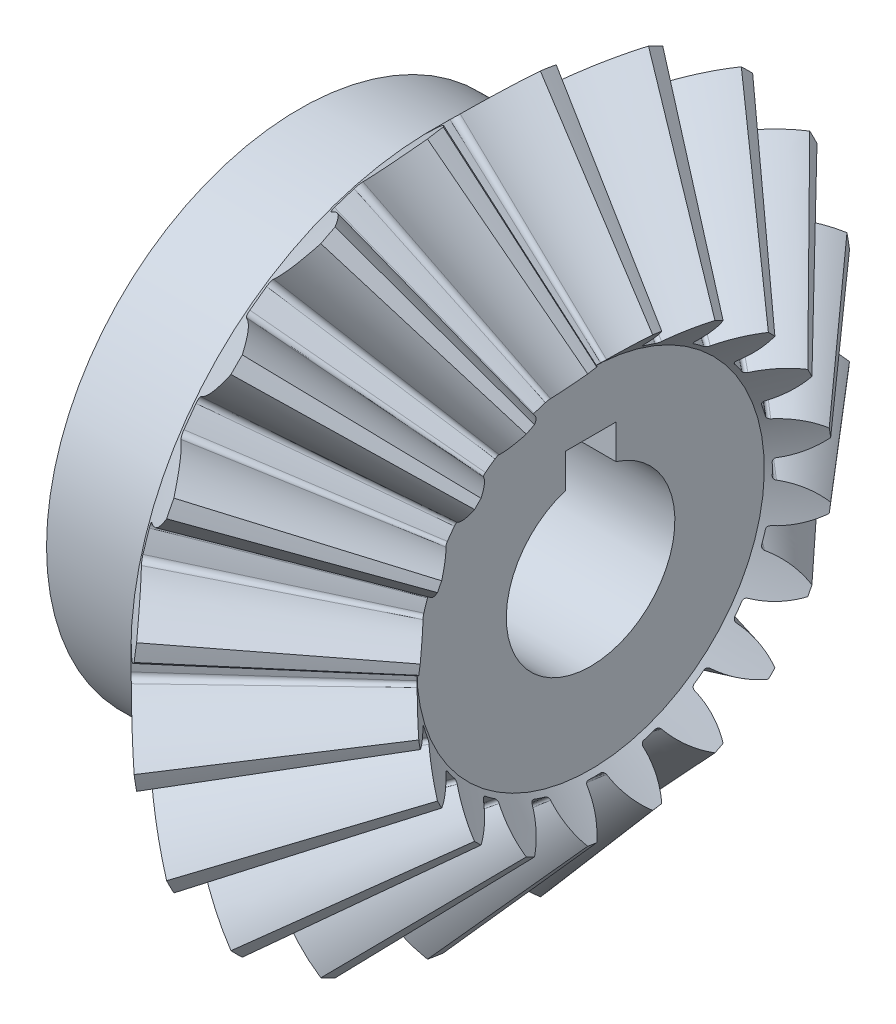
from build123d import *

# Parameters (mm, degrees)
TEETHCUTS_COUNT = 20
TEETHCUTS_ANGLE = 342
HUBSKE_R        = 15
HUB_DEPTH       = 7.901802976
BORSKE_R        = 5
BORE_DEPTH      = 30.0027432
KEYSKE_W        = 3
KEYSKE_H        = 6.8
KEYWAY_DEPTH    = 30.0027432
THREAD4_PITCH   = 0.3


with BuildPart() as part:
    # BasProSke → Base-Revolve (revolve)
    with BuildSketch(Plane(origin=(0, 0, 0), x_dir=(1, 0, 0), z_dir=(0, 1, 0)), mode=Mode.PRIVATE) as base_revolve_sk:
        Polygon((0, 0), (0, 17.899008978), (3.515204589, 21.414213561), (11.400485955, 12.328932179), (9.376656368, 10.305102596), (9.376656368, 0), align=None)
    revolve(base_revolve_sk.sketch.rotate(Axis((-10, 0, 0), (1, 0, 0)), 180), axis=Axis((-10, 0, 0), (1, 0, 0)))

    # ToothCut: read off the stored shape, not the designer's step
    # ToothCut: loft between two sections, ruled curve by curve
    toothcut_from = [
        Edge.make_bspline([(22.107036673, 0.006045648, -0.009390945), (22.102810287, 0.001819262, -0.014832638), (22.097123249, -0.003867777, -0.014025248), (22.093746048, -0.007244978, -0.007504073)], [0, 0, 0, 0, 1, 1, 1, 1], 3, [1, 0.779000961, 0.779000961, 1]),
        Edge.make_bspline([(22.093746048, -0.007244978, 0.007504073), (22.097123249, -0.003867777, 0.014025248), (22.102810287, 0.001819262, 0.014832638), (22.107036673, 0.006045648, 0.009390945)], [0, 0, 0, 0, 1, 1, 1, 1], 3, [1, 0.779000961, 0.779000961, 1]),
        Edge.make_bspline([(22.093746048, -0.007244978, -0.007504073), (22.093246357, -0.007744669, -0.006539199), (22.09284735, -0.008143676, -0.005484709), (22.092556922, -0.008434103, -0.004361469)], [0, 0, 0, 0, 1, 1, 1, 1], 3, [1, 0.993403623, 0.993403623, 1]),
        Edge.make_bspline([(22.092556922, -0.008434103, 0.004361469), (22.09284735, -0.008143676, 0.005484709), (22.093246357, -0.007744669, 0.006539199), (22.093746048, -0.007244978, 0.007504073)], [0, 0, 0, 0, 1, 1, 1, 1], 3, [1, 0.993403623, 0.993403623, 1]),
        Edge.make_bspline([(22.092556922, -0.008434103, -0.004361469), (22.091821001, -0.009170025, -0.001515261), (22.091821001, -0.009170025, 0.001515261), (22.092556922, -0.008434103, 0.004361469)], [0, 0, 0, 0, 1, 1, 1, 1], 3, [1, 0.959453942, 0.959453942, 1]),
        Edge.make_line((22.107036673, 0.006045648, 0.009390945), (22.107036673, 0.006045648, -0.009390945)),
    ]
    toothcut_to = [
        Edge.make_bspline([(3.663019018, 21.56202799, -3.211244356), (2.831810312, 20.730819285, -2.040553938), (1.789743173, 19.688752148, -1.278632658), (0.63374798, 18.532756957, -0.996352455)], [0, 0, 0, 0, 1, 1, 1, 1], 3, [1, 0.968994199, 0.968994199, 1]),
        Edge.make_bspline([(0.63374798, 18.532756957, 0.996352455), (1.789743173, 19.688752148, 1.278632658), (2.831810312, 20.730819285, 2.040553938), (3.663019018, 21.56202799, 3.211244356)], [0, 0, 0, 0, 1, 1, 1, 1], 3, [1, 0.968994199, 0.968994199, 1]),
        Edge.make_bspline([(0.63374798, 18.532756957, -0.996352455), (0.496005207, 18.395014184, -0.962717317), (0.407835311, 18.306844288, -0.80932369), (0.412687652, 18.311696629, -0.611762623)], [0, 0, 0, 0, 1, 1, 1, 1], 3, [1, 0.835736227, 0.835736227, 1]),
        Edge.make_bspline([(0.412687652, 18.311696629, 0.611762623), (0.407835311, 18.306844288, 0.80932369), (0.496005207, 18.395014184, 0.962717317), (0.63374798, 18.532756957, 0.996352455)], [0, 0, 0, 0, 1, 1, 1, 1], 3, [1, 0.835736227, 0.835736227, 1]),
        Edge.make_bspline([(0.412687652, 18.311696629, -0.611762623), (0.422702729, 18.321711707, -0.204002844), (0.422702729, 18.321711707, 0.204002844), (0.412687652, 18.311696629, 0.611762623)], [0, 0, 0, 0, 1, 1, 1, 1], 3, [1, 0.999598195, 0.999598195, 1]),
        Edge.make_line((3.663019018, 21.56202799, 3.211244356), (3.663019018, 21.56202799, -3.211244356)),
    ]
    toothcut = Solid(Shell([*[Face.make_surface_from_curves(toothcut_from[k], toothcut_to[k]) for k in range(6)], Face(Wire(toothcut_from)), Face(Wire(toothcut_to))]))
    add(toothcut, mode=Mode.SUBTRACT)

    # TeethCuts: ToothCut ×20 about axis
    teethcuts_axis = Axis((-10, 0, 0), (1, 0, 0))
    for i in range(1, TEETHCUTS_COUNT):
        add(toothcut.rotate(teethcuts_axis, i * TEETHCUTS_ANGLE / (TEETHCUTS_COUNT - 1)), mode=Mode.SUBTRACT)

    # HubSke → Hub (add)
    with BuildSketch(Plane.ZY):
        with Locations(Location((0, 0, 0), (0, 0, 180))):
            Circle(HUBSKE_R)
    extrude(amount=HUB_DEPTH)

    # BorSke → Bore (cut, symmetric)
    with BuildSketch(Plane(origin=(0, 0, 0), x_dir=(0, 0, -1), z_dir=(1, 0, 0))):
        with Locations(Location((0, 0, 0), (0, 0, 180))):
            Circle(BORSKE_R)
    extrude(amount=BORE_DEPTH, both=True, mode=Mode.SUBTRACT)

    # KeySke → Keyway (cut, symmetric)
    with BuildSketch(Plane(origin=(0, 0, 0), x_dir=(0, 0, -1), z_dir=(1, 0, 0))):
        with Locations((0, 3.4)):
            Rectangle(KEYSKE_W, KEYSKE_H)
    extrude(amount=KEYWAY_DEPTH, both=True, mode=Mode.SUBTRACT)

    # Sketch1 → CBORE for M2.5 SHCS1 (revolve, cut)
    with BuildSketch(Plane(origin=(-3.937080358, -11.535008497, -9.588721447), x_dir=(0, 0.6392480964452122, -0.769000566443987), z_dir=(1, 0, 0))):
        Polygon((0, 0), (0, 15.871247898), (1.45, 15), (1.45, 2.5), (2.75, 2.5), (2.75, 0.025), (2.775, 0), align=None)
    revolve(axis=Axis((-3.937080358, -16.418162094, -13.647946859), (0, 0.769000566443987, 0.6392480964452122)), mode=Mode.SUBTRACT)

    # Thread4: arcs per turn and ends read off the stored shape
    # Thread4: the profile of Thread Profile3 profile screwed along a right-hand helix through 50 turns, 6 arcs to a turn; built about Z, then put on its axis
    thread4_z = Axis((0, 0, 0), (0, 0, 1))
    thread4_corners = [(1.4497, 0, -0.000173204), (1.612379762, 0, 0.09375), (1.612379762, 0, 0.13125), (1.4497, 0, 0.225173205)]
    with BuildLine(mode=Mode.PRIVATE) as thread4_profile:
        Line(thread4_corners[0], thread4_corners[1])
        Line(thread4_corners[1], thread4_corners[2])
        Line(thread4_corners[2], thread4_corners[3])
        Line(thread4_corners[3], thread4_corners[0])
    thread4_cap = Face(thread4_profile.wire())
    thread4_turn_angles = [0, 30, 60, 90, 120, 150, 180, 210, 240, 270, 300, 330, 360]
    thread4_turn_weights = [1, 0.8660254037844387, 1, 0.8660254037844387, 1, 0.8660254037844387, 1, 0.8660254037844387, 1, 0.8660254037844387, 1, 0.8660254037844387, 1]
    thread4_turn_rails = [Edge.make_bspline([Vector(p[0], p[1], 0).rotate(thread4_z, thread4_turn_angles[k]) / thread4_turn_weights[k] + Vector(0, 0, p[2] + THREAD4_PITCH * thread4_turn_angles[k] / 360) for k in range(13)], [0, 0, 0, 1, 1, 2, 2, 3, 3, 4, 4, 5, 5, 6, 6, 6], 2, thread4_turn_weights) for p in thread4_corners]
    thread4_turn_sides = [Face.make_surface_from_curves(thread4_turn_rails[p[0]], thread4_turn_rails[p[1]]) for p in [(0, 1), (1, 2), (2, 3), (3, 0)]]
    thread4 = Plane(origin=(-3.937080358, -9.612507081, -7.990601206), x_dir=(1, 0, 0), z_dir=(0, 0.769000566, 0.639248096)) * Solid(Shell([*[p.moved(Location((0, 0, THREAD4_PITCH * i))) for i in range(50) for p in thread4_turn_sides], thread4_cap, thread4_cap.rotate(thread4_z, 18000).moved(Location((0, 0, THREAD4_PITCH * 18000 / 360)))]))
    add(thread4, mode=Mode.SUBTRACT)


solid = part.part
